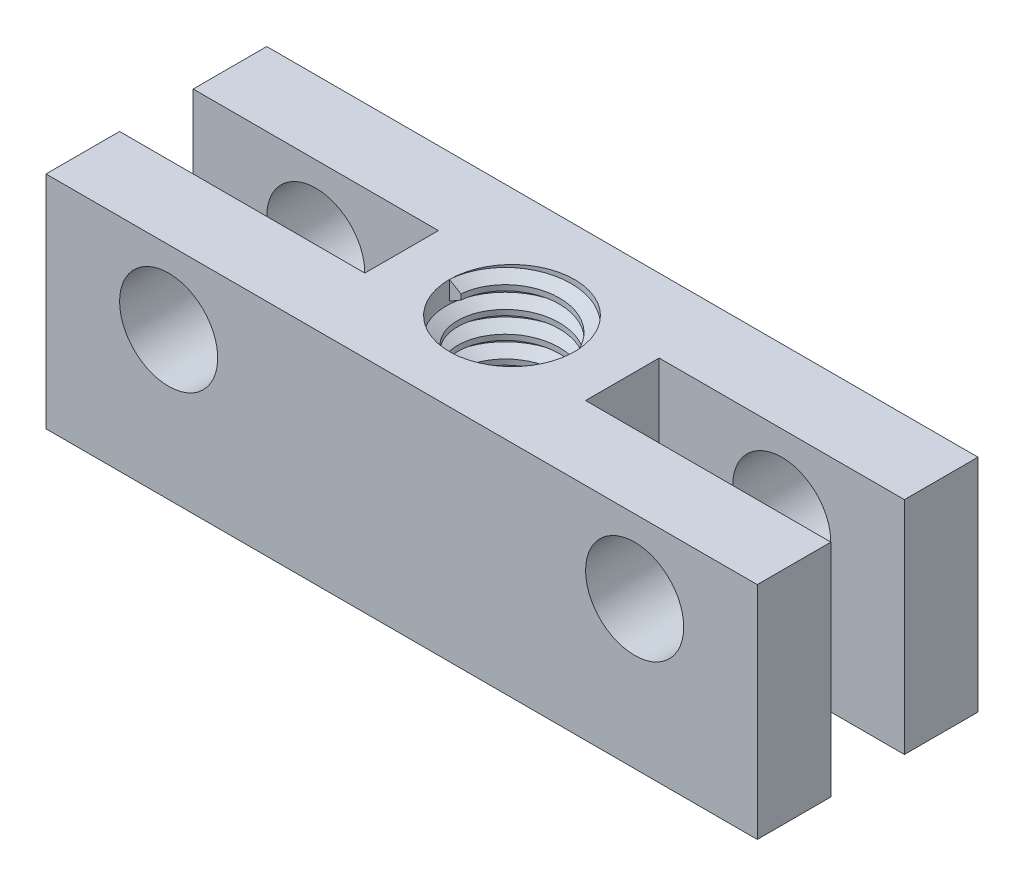
from build123d import *
from build123d.topology import SkipClean

# Parameters (mm, degrees)
SKETCH1_W           = 18
SKETCH1_H           = 6
SKETCH1_W_2         = 58
BOSS_EXTRUDE1_DEPTH = 18
M12_TAPPED_HOLE1_D  = 10.2
THREAD1_PITCH       = 1.75
SKETCH6_R           = 4
CUT_EXTRUDE1_DEPTH  = 43.074413238


with BuildPart() as part:
    # Sketch1 → Boss-Extrude1 (new body)
    with BuildSketch(Plane(origin=(0, 0, 0), x_dir=(1, 0, 0), z_dir=(0, 1, 0))):
        with Locations((-4.5, -1.5)):
            Rectangle(SKETCH1_W, SKETCH1_H)
        with Locations((-4.5, -7.5)):
            Rectangle(SKETCH1_W_2, SKETCH1_H)
        with Locations((-4.5, 4.5)):
            Rectangle(SKETCH1_W_2, SKETCH1_H)
    extrude(amount=BOSS_EXTRUDE1_DEPTH)

    # M12 Tapped Hole1 (through all)
    with Locations(Plane(origin=(-4.5, 18, 1.5), x_dir=(0, 0, 1), z_dir=(0, 1, 0))):
        with Locations((0, 0)):
            Hole(M12_TAPPED_HOLE1_D / 2)

    # Thread1: the profile of Thread Profile1 profile screwed along a right-hand helix of 10.285714 turns, 10 arcs to a turn; built about Z, then put on its axis
    with SkipClean():  # the faces are left unmerged after this step: merging them gives an invalid solid
        thread1_z = Axis((0, 0, 0), (0, 0, 1))
        thread1_corners = [(5.1003, 0, -0.000173205), (5.1003, 0, 1.5314232), (4.152784719, 0, 0.984374998), (4.152784719, 0, 0.546874998)]
        with BuildLine(mode=Mode.PRIVATE) as thread1_profile:
            Line(thread1_corners[0], thread1_corners[1])
            Line(thread1_corners[1], thread1_corners[2])
            Line(thread1_corners[2], thread1_corners[3])
            Line(thread1_corners[3], thread1_corners[0])
        thread1_cap = Face(thread1_profile.wire())
        thread1_turn_angles = [0, 18, 36, 54, 72, 90, 108, 126, 144, 162, 180, 198, 216, 234, 252, 270, 288, 306, 324, 342, 360]
        thread1_turn_weights = [1, 0.9510565162951535, 1, 0.9510565162951535, 1, 0.9510565162951535, 1, 0.9510565162951535, 1, 0.9510565162951535, 1, 0.9510565162951535, 1, 0.9510565162951535, 1, 0.9510565162951535, 1, 0.9510565162951535, 1, 0.9510565162951535, 1]
        thread1_turn_rails = [Edge.make_bspline([Vector(p[0], p[1], 0).rotate(thread1_z, thread1_turn_angles[k]) / thread1_turn_weights[k] + Vector(0, 0, p[2] + THREAD1_PITCH * thread1_turn_angles[k] / 360) for k in range(21)], [0, 0, 0, 1, 1, 2, 2, 3, 3, 4, 4, 5, 5, 6, 6, 7, 7, 8, 8, 9, 9, 10, 10, 10], 2, thread1_turn_weights) for p in thread1_corners]
        thread1_turn_sides = [Face.make_surface_from_curves(thread1_turn_rails[p[0]], thread1_turn_rails[p[1]]) for p in [(0, 1), (1, 2), (2, 3), (3, 0)]]
        thread1_last_angles = [3600, 3618, 3636, 3654, 3672, 3687.428571429, 3702.857142857]
        thread1_last_weights = [1, 0.9510565162951535, 1, 0.9510565162951535, 1, 0.9639628606958538, 1]
        thread1_last_rails = [Edge.make_bspline([Vector(p[0], p[1], 0).rotate(thread1_z, thread1_last_angles[k]) / thread1_last_weights[k] + Vector(0, 0, p[2] + THREAD1_PITCH * thread1_last_angles[k] / 360) for k in range(7)], [0, 0, 0, 1, 1, 2, 2, 3, 3, 3], 2, thread1_last_weights) for p in thread1_corners]
        thread1_last_sides = [Face.make_surface_from_curves(thread1_last_rails[p[0]], thread1_last_rails[p[1]]) for p in [(0, 1), (1, 2), (2, 3), (3, 0)]]
        thread1 = Plane(origin=(-4.5, 18, 1.5), x_dir=(-1, 0, 0), z_dir=(0, -1, 0)) * Solid(Shell([*[p.moved(Location((0, 0, THREAD1_PITCH * i))) for i in range(10) for p in thread1_turn_sides], *thread1_last_sides, thread1_cap, thread1_cap.rotate(thread1_z, 3702.857142857).moved(Location((0, 0, THREAD1_PITCH * 3702.857142857 / 360)))]))
        add(thread1)

    # Sketch6 → Cut-Extrude1 (cut, through all)
    with SkipClean():  # the faces are left unmerged after this step: merging them gives an invalid solid
        with BuildSketch(Plane(origin=(0, 0, -7.5), x_dir=(-1, 0, 0), z_dir=(0, 0, -1))):
            with Locations((23.5, 12)):
                Circle(SKETCH6_R)
            with Locations((-14.5, 12)):
                Circle(SKETCH6_R)
        extrude(amount=-CUT_EXTRUDE1_DEPTH, mode=Mode.SUBTRACT)


solid = part.part
